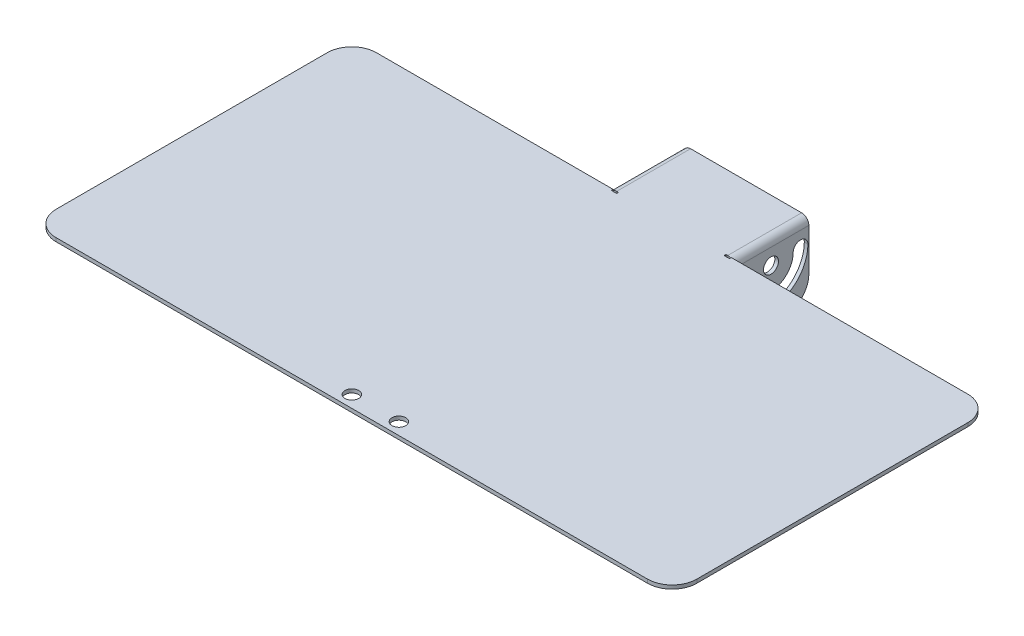
from build123d import *

# Parameters (mm, degrees)
BASE_FLANGE1_DEPTH   = 0.7366
FILLET1_R            = 5
FILLET2_R            = 5
FILLET3_R            = 5
FILLET4_R            = 5
EDGE_FLANGE2_START   = -47.5
EDGE_FLANGE2_DEPTH   = 15.3683
EDGE_FLANGE2_START_2 = -32.5
EDGE_FLANGE2_2_DEPTH = 0.3683
EDGE_FLANGE2_3_DEPTH = 15
FILLET7_R            = 5
FILLET8_R            = 5
SKETCH18_R           = 1.5
CUT_EXTRUDE1_DEPTH   = 40
SKETCH23_R           = 1.52
CUT_EXTRUDE6_DEPTH   = 30
SKETCH25_R           = 1.4
CUT_EXTRUDE8_DEPTH   = 10


with BuildPart() as part:
    # Base-Flange1: sheet metal written as solids
    # Sketch1 → Base-Flange1 (new body)
    with BuildSketch(Plane(origin=(0, 0, 0), x_dir=(1, 0, 0), z_dir=(0, 1, 0))):
        Polygon((19.610938441, 32.5), (65, 32.5), (65, -32.5), (-65, -32.5), (-65, 32.5), (-19.610938441, 32.5), (-11.999061559, 32.5), (-11.999061559, 47.5), (12.000938441, 47.5), (12.000938441, 32.5), align=None)
    extrude(amount=-BASE_FLANGE1_DEPTH)

    # Fillet1
    fillet1_edges = [part.edges().sort_by_distance(p)[0] for p in [
        (65, -0.3683, 32.5),
    ]]
    fillet(fillet1_edges, radius=FILLET1_R)

    # Fillet2
    fillet2_edges = [part.edges().sort_by_distance(p)[0] for p in [
        (65, -0.3683, -32.5),
    ]]
    fillet(fillet2_edges, radius=FILLET2_R)

    # Fillet3
    fillet3_edges = [part.edges().sort_by_distance(p)[0] for p in [
        (-65, -0.3683, 32.5),
    ]]
    fillet(fillet3_edges, radius=FILLET3_R)

    # Fillet4
    fillet4_edges = [part.edges().sort_by_distance(p)[0] for p in [
        (-65, -0.3683, -32.5),
    ]]
    fillet(fillet4_edges, radius=FILLET4_R)

    # Edge-Flange2: read off the stored shape, not the designer's step
    # Edge-Flange2 outline → Edge-Flange2 (cut)
    with BuildSketch(Plane.XY.offset(EDGE_FLANGE2_START)):
        with BuildLine():
            ThreePointArc((-11.999061559, -0.197371375), (-11.643753776, -0.050198073), (-11.262461559, 0))
            Line((-11.262461559, 0), (-11.999061559, 0))
            Line((-11.999061559, 0), (-11.999061559, -0.197371375))
        make_face()
        with BuildLine():
            ThreePointArc((11.264338441, 0), (11.645630659, -0.050198073), (12.000938441, -0.197371375))
            Line((12.000938441, -0.197371375), (12.000938441, 0))
            Line((12.000938441, 0), (11.264338441, 0))
        make_face()
    extrude(amount=EDGE_FLANGE2_DEPTH, mode=Mode.SUBTRACT)

    # Edge-Flange2 2 outline → Edge-Flange2 2 (cut)
    with BuildSketch(Plane.XY.offset(EDGE_FLANGE2_START_2)):
        with BuildLine():
            Line((-11.999061559, -0.7366), (-10.894161559, -0.7366))
            Line((-10.894161559, -0.7366), (-10.894161559, 0))
            Line((-10.894161559, 0), (-11.262461559, 0))
            ThreePointArc((-11.262461559, 0), (-11.643753776, -0.050198073), (-11.999061559, -0.197371375))
            Line((-11.999061559, -0.197371375), (-11.999061559, -0.7366))
        make_face()
        with BuildLine():
            Line((12.000938441, -0.7366), (12.000938441, -0.197371375))
            ThreePointArc((12.000938441, -0.197371375), (11.645630659, -0.050198073), (11.264338441, 0))
            Line((11.264338441, 0), (10.896038441, 0))
            Line((10.896038441, 0), (10.896038441, -0.7366))
            Line((10.896038441, -0.7366), (12.000938441, -0.7366))
        make_face()
    extrude(amount=EDGE_FLANGE2_2_DEPTH, mode=Mode.SUBTRACT)

    # Edge-Flange2 3 outline → Edge-Flange2 3 (add)
    with BuildSketch(Plane.XY.offset(EDGE_FLANGE2_START)):
        with BuildLine():
            ThreePointArc((-11.999061559, -1.4732), (-11.783316414, -0.952345145), (-11.262461559, -0.7366))
            Line((-11.262461559, -0.7366), (-11.999061559, -0.7366))
            Line((-11.999061559, -0.7366), (-11.999061559, -0.197371375))
            ThreePointArc((-11.999061559, -0.197371375), (-12.538290183, -0.7366), (-12.735661559, -1.4732))
            Line((-12.735661559, -1.4732), (-12.735661559, -15))
            Line((-12.735661559, -15), (-11.999061559, -15))
            Line((-11.999061559, -15), (-11.999061559, -1.4732))
        make_face()
        with BuildLine():
            Line((12.737538441, -15), (12.737538441, -1.4732))
            ThreePointArc((12.737538441, -1.4732), (12.540167066, -0.7366), (12.000938441, -0.197371375))
            Line((12.000938441, -0.197371375), (12.000938441, -0.7366))
            Line((12.000938441, -0.7366), (11.264338441, -0.7366))
            ThreePointArc((11.264338441, -0.7366), (11.785193296, -0.952345145), (12.000938441, -1.4732))
            Line((12.000938441, -1.4732), (12.000938441, -15))
            Line((12.000938441, -15), (12.737538441, -15))
        make_face()
    extrude(amount=EDGE_FLANGE2_3_DEPTH)

    # Fillet7
    fillet7_edges = [part.edges().sort_by_distance(p)[0] for p in [
        (12.369238441, -15, -47.5),
    ]]
    fillet(fillet7_edges, radius=FILLET7_R)

    # Fillet8
    fillet8_edges = [part.edges().sort_by_distance(p)[0] for p in [
        (-12.367361559, -15, -47.5),
    ]]
    fillet(fillet8_edges, radius=FILLET8_R)

    # Sketch18 → Cut-Extrude1 (cut)
    with BuildSketch(Plane.ZY.offset(12.735661559)):
        with Locations(Location((-39.810498868, -4.68598948, 0), (0, 0, 270))):
            Circle(SKETCH18_R)
        with BuildLine():
            ThreePointArc((-39.496869826, -12.179429066), (-38.060907717, -10.61801534), (-39.622321443, -9.182053232))
            ThreePointArc((-39.622321443, -9.182053232), (-42.925238149, -7.933819403), (-44.310498868, -4.68598948))
            ThreePointArc((-44.310498868, -4.68598948), (-45.810498868, -3.18598948), (-47.310498868, -4.68598948))
            ThreePointArc((-47.310498868, -4.68598948), (-45.001731004, -10.099039351), (-39.496869826, -12.179429066))
        make_face()
    extrude(amount=-CUT_EXTRUDE1_DEPTH, mode=Mode.SUBTRACT)

    # Sketch23 → Cut-Extrude6 (cut)
    with BuildSketch(Plane(origin=(13.900294902, -27.805223525, -244.007014279), x_dir=(-3.6601011800335994e-15, 0.31934249234828205, -0.9476393684207024), z_dir=(1, 0, 0))):
        with Locations(Location((-186.121703077, 87.117320509, 0), (0, 0, 251.376833723))):
            Circle(SKETCH23_R)
    extrude(amount=-CUT_EXTRUDE6_DEPTH, mode=Mode.SUBTRACT)

    # Sketch25 → Cut-Extrude8 (cut)
    with BuildSketch(Plane(origin=(-71.983966672, 0, -96.098250098), x_dir=(1, 0, 0), z_dir=(0, 1, 0))):
        with Locations(Location((79.090906604, -126.157708005, 0), (0, 0, 270))):
            Circle(SKETCH25_R)
        with Locations(Location((69.540906604, -126.157708005, 0), (0, 0, 270))):
            Circle(SKETCH25_R)
    extrude(amount=-CUT_EXTRUDE8_DEPTH, mode=Mode.SUBTRACT)


solid = part.part
